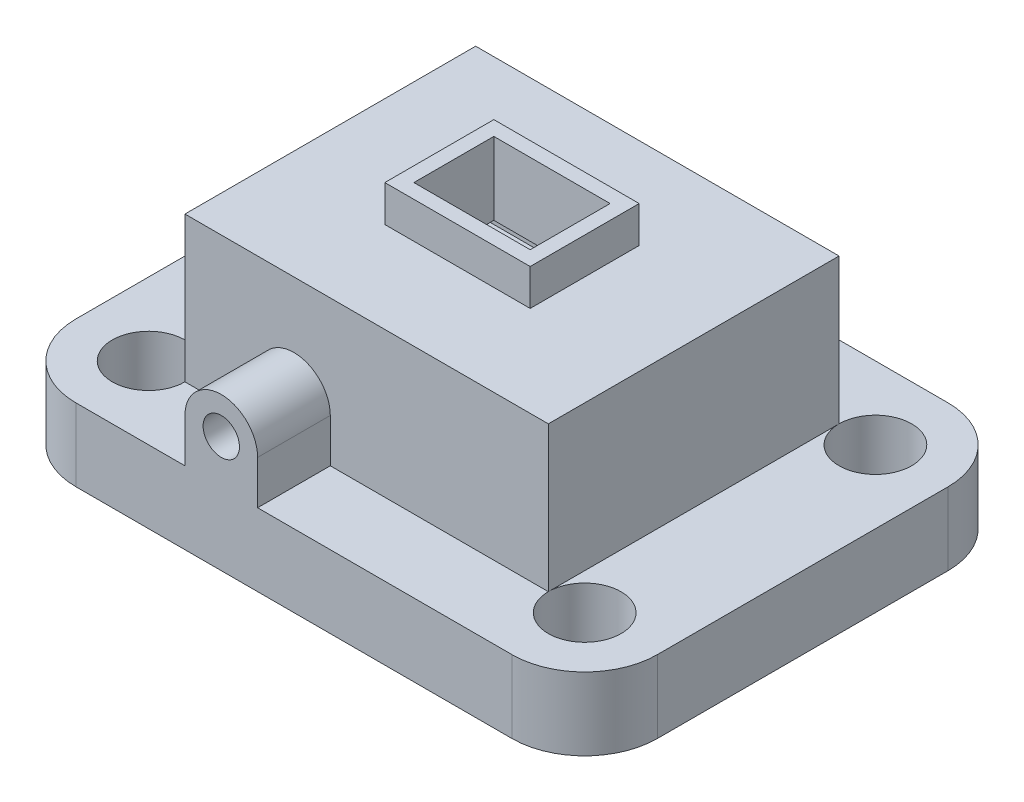
from build123d import *

# Parameters (mm, degrees)
SKETCH_1_R            = 10
SKETCH_1_R_2          = 5
EXTRUDE_2_DEPTH       = 10
SKETCH_3_R            = 2.5
EXTRUDE_4_DEPTH       = 10
EXTRUDE_1_OUTLINE_W   = 50
EXTRUDE_1_OUTLINE_H   = 40
EXTRUDE_1_OUTLINE_W_2 = 40
EXTRUDE_1_OUTLINE_H_2 = 30
EXTRUDE_1_DEPTH       = 20
EXTRUDE_1_2_OUTLINE_W = 40
EXTRUDE_1_2_OUTLINE_H = 30
EXTRUDE_1_2_DEPTH     = 5
EXTRUDE_START         = 15
EXTRUDE_1_3_OUTLINE_W = 40
EXTRUDE_1_3_OUTLINE_H = 30
EXTRUDE_1_3_DEPTH     = 5
EXTRUDE_2_2_DEPTH     = 5
SKETCH_15_R           = 2.5
CUT_EXTRUDE_3_DEPTH   = 15
SKETCH_20_W           = 16
SKETCH_20_H           = 11
CUT_EXTRUDE_7_DEPTH   = 10


# Read off the part's stored shape, not the designer's step: 拉伸-薄壁1
with BuildPart() as part:
    # 草图1 → Extrude 2 (new body)
    # profile 1 of 7: a face of its own
    with BuildSketch(Plane(origin=(0, 0, 0), x_dir=(1, 0, 0), z_dir=(0, 1, 0))):
        with BuildLine():
            Line((70, 0), (40, 0))
            Line((40, 0), (40, -30))
            Line((40, -30), (40, -60))
            Line((40, -60), (70, -60))
            ThreePointArc((70, -60), (62.928932188, -42.928932188), (80, -50))
            Line((80, -50), (80, -10))
            ThreePointArc((80, -10), (62.928932188, -17.071067812), (70, 0))
        make_face()
    # profile 2 of 7: a face of its own
    with BuildSketch(Plane(origin=(0, 0, 0), x_dir=(1, 0, 0), z_dir=(0, 1, 0))):
        with BuildLine():
            Line((40, -30), (40, 0))
            Line((40, 0), (10, 0))
            ThreePointArc((10, 0), (17.071067812, -2.928932188), (20, -10))
            ThreePointArc((20, -10), (10, -20), (0, -10))
            Line((0, -10), (0, -30))
            Line((0, -30), (40, -30))
        make_face()
    # profile 3 of 7: a face of its own
    with BuildSketch(Plane(origin=(0, 0, 0), x_dir=(1, 0, 0), z_dir=(0, 1, 0))):
        with BuildLine():
            Line((40, -60), (40, -30))
            Line((40, -30), (0, -30))
            Line((0, -30), (0, -50))
            ThreePointArc((0, -50), (10, -40), (20, -50))
            ThreePointArc((20, -50), (17.071067812, -57.071067812), (10, -60))
            Line((10, -60), (40, -60))
        make_face()
    # profile 4 of 7: a face of its own
    with BuildSketch(Plane(origin=(0, 0, 0), x_dir=(1, 0, 0), z_dir=(0, 1, 0))):
        with Locations((10, -50)):
            Circle(SKETCH_1_R)
        with Locations(Location((10, -50, 0), (0, 0, 270))):
            Circle(SKETCH_1_R_2, mode=Mode.SUBTRACT)
    # profile 5 of 7: a face of its own
    with BuildSketch(Plane(origin=(0, 0, 0), x_dir=(1, 0, 0), z_dir=(0, 1, 0))):
        with Locations((70, -50)):
            Circle(SKETCH_1_R)
        with Locations(Location((70, -50, 0), (0, 0, 270))):
            Circle(SKETCH_1_R_2, mode=Mode.SUBTRACT)
    # profile 6 of 7: a face of its own
    with BuildSketch(Plane(origin=(0, 0, 0), x_dir=(1, 0, 0), z_dir=(0, 1, 0))):
        with Locations((70, -10)):
            Circle(SKETCH_1_R)
        with Locations(Location((70, -10, 0), (0, 0, 270))):
            Circle(SKETCH_1_R_2, mode=Mode.SUBTRACT)
    # profile 7 of 7: a face of its own
    with BuildSketch(Plane(origin=(0, 0, 0), x_dir=(1, 0, 0), z_dir=(0, 1, 0))):
        with Locations((10, -10)):
            Circle(SKETCH_1_R)
        with Locations(Location((10, -10, 0), (0, 0, 270))):
            Circle(SKETCH_1_R_2, mode=Mode.SUBTRACT)
    extrude(amount=EXTRUDE_2_DEPTH)

    # 草图3 → 凸台-拉伸4 (add)
    with BuildSketch(Plane.XY.offset(60)):
        with BuildLine():
            Line((25, 16), (25, 10))
            Line((25, 10), (35, 10))
            Line((35, 10), (35, 16))
            ThreePointArc((35, 16), (30, 21), (25, 16))
        make_face()
        with Locations((30, 16)):
            Circle(SKETCH_3_R, mode=Mode.SUBTRACT)
    extrude(amount=-EXTRUDE_4_DEPTH)

    # 拉伸-薄壁1 outline → 拉伸-薄壁1 (add)
    with BuildSketch(Plane(origin=(0, 10, 0), x_dir=(1, 0, 0), z_dir=(0, 1, 0))):
        with Locations((40, -30)):
            Rectangle(EXTRUDE_1_OUTLINE_W, EXTRUDE_1_OUTLINE_H)
        with Locations((40, -30)):
            Rectangle(EXTRUDE_1_OUTLINE_W_2, EXTRUDE_1_OUTLINE_H_2, mode=Mode.SUBTRACT)
    extrude(amount=EXTRUDE_1_DEPTH)

    # Extrude 1 2 outline → Extrude 1 2 (add)
    with BuildSketch(Plane(origin=(0, 10, 0), x_dir=(1, 0, 0), z_dir=(0, 1, 0))):
        with Locations((40, -30)):
            Rectangle(EXTRUDE_1_2_OUTLINE_W, EXTRUDE_1_2_OUTLINE_H)
    extrude(amount=EXTRUDE_1_2_DEPTH)

    # Extrude 1 3 outline → Extrude 1 3 (add)
    with BuildSketch(Plane(origin=(0, 10, 0), x_dir=(1, 0, 0), z_dir=(0, 1, 0)).offset(EXTRUDE_START)):
        with Locations((40, -30)):
            Rectangle(EXTRUDE_1_3_OUTLINE_W, EXTRUDE_1_3_OUTLINE_H)
    extrude(amount=EXTRUDE_1_3_DEPTH)

    # 草图14 → Extrude 2 2 (add)
    with BuildSketch(Plane(origin=(0, 30, 0), x_dir=(1, 0, 0), z_dir=(0, 1, 0))):
        Polygon((30, -37.5), (30, -22.5), (40, -22.5), (50, -22.5), (50, -37.5), (40, -37.5), align=None)
        Polygon((32, -35.5), (32, -24.5), (40, -24.5), (48, -24.5), (48, -35.5), (40, -35.5), align=None, mode=Mode.SUBTRACT)
    extrude(amount=EXTRUDE_2_2_DEPTH)

    # 草图15 → 切除-拉伸3 (cut)
    with BuildSketch(Plane.XY.offset(60)):
        with Locations((30, 16)):
            Circle(SKETCH_15_R)
    extrude(amount=-CUT_EXTRUDE_3_DEPTH, mode=Mode.SUBTRACT)

    # 草图20 → 切除-拉伸7 (cut)
    with BuildSketch(Plane(origin=(0, 30, 0), x_dir=(1, 0, 0), z_dir=(0, 1, 0))):
        with Locations((40, -30)):
            Rectangle(SKETCH_20_W, SKETCH_20_H)
    extrude(amount=-CUT_EXTRUDE_7_DEPTH, mode=Mode.SUBTRACT)


solid = part.part
